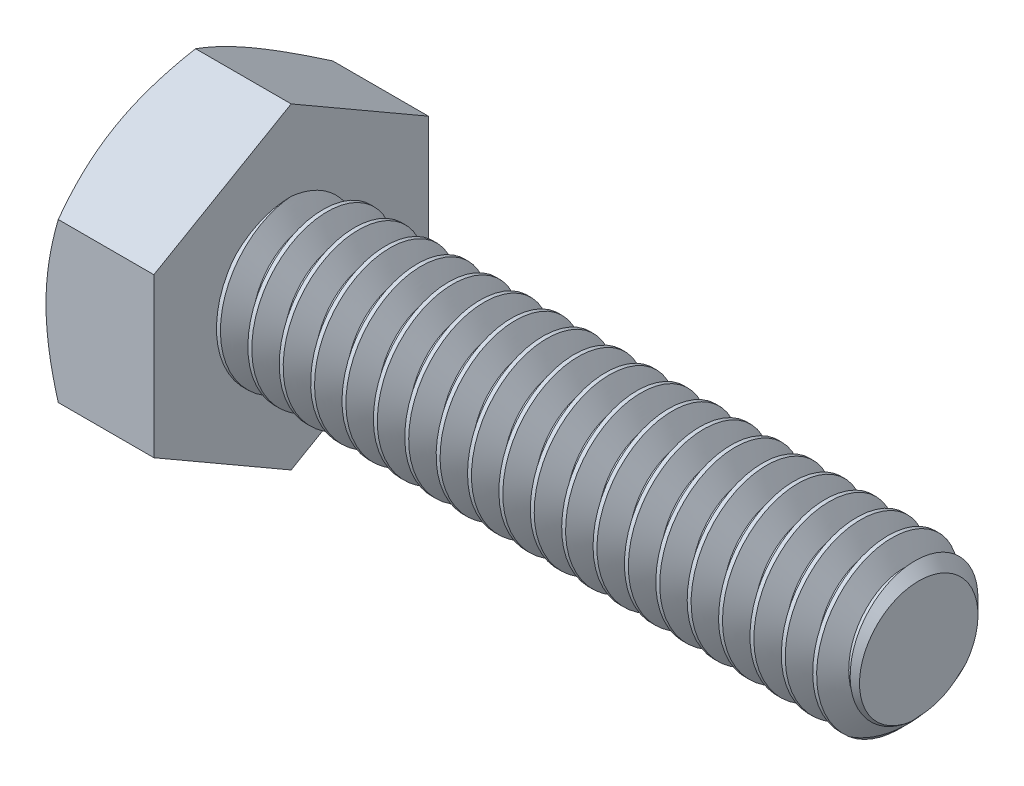
from build123d import *

# Parameters (mm, degrees)
SKETCH5_R           = 3.175
BOSS_EXTRUDE3_DEPTH = 25.4
CHAMFER1_SIZE       = 0.77724
CUT_SWEEP1_PITCH    = 1.27
BOSS_EXTRUDE4_DEPTH = 4.365625
SKETCH8_OUTSIDE_W   = 130.65
SKETCH8_OUTSIDE_H   = 132.37
SKETCH8_OUTSIDE_R   = 5.55625
CUT_EXTRUDE3_DEPTH  = 31.952009727
CUT_EXTRUDE3_DRAFT  = -60
CUT_EXTRUDE4_DEPTH  = 0.254
CIRPATTERN1_COUNT   = 3


with BuildPart() as part:
    # Sketch5 → Boss-Extrude3 (new body)
    with BuildSketch(Plane(origin=(14.8828125, 0, 0), x_dir=(0, 0, -1), z_dir=(1, 0, 0))):
        Circle(SKETCH5_R)
    extrude(amount=-BOSS_EXTRUDE3_DEPTH)

    # Chamfer1
    chamfer1_edges = [part.edges().sort_by_distance(p)[0] for p in [
        (14.8828125, 0, 3.175),
    ]]
    chamfer(chamfer1_edges, length=CHAMFER1_SIZE)

    # Cut-Sweep1: the profile of Sketch10 profile screwed along a right-hand helix of 21 turns, 8 arcs to a turn; built about Z, then put on its axis
    cut_sweep1_z = Axis((0, 0, 0), (0, 0, 1))
    cut_sweep1_corners = [(3.1753, 0, 0.000173205), (2.350110803, 0, -0.47625), (2.350110803, 0, -0.635), (3.1753, 0, -1.111423205)]
    with BuildLine(mode=Mode.PRIVATE) as cut_sweep1_profile:
        Line(cut_sweep1_corners[0], cut_sweep1_corners[1])
        Line(cut_sweep1_corners[1], cut_sweep1_corners[2])
        Line(cut_sweep1_corners[2], cut_sweep1_corners[3])
        Line(cut_sweep1_corners[3], cut_sweep1_corners[0])
    cut_sweep1_cap = Face(cut_sweep1_profile.wire())
    cut_sweep1_turn_angles = [0, 22.5, 45, 67.5, 90, 112.5, 135, 157.5, 180, 202.5, 225, 247.5, 270, 292.5, 315, 337.5, 360]
    cut_sweep1_turn_weights = [1, 0.9238795325112867, 1, 0.9238795325112867, 1, 0.9238795325112867, 1, 0.9238795325112867, 1, 0.9238795325112867, 1, 0.9238795325112867, 1, 0.9238795325112867, 1, 0.9238795325112867, 1]
    cut_sweep1_turn_rails = [Edge.make_bspline([Vector(p[0], p[1], 0).rotate(cut_sweep1_z, cut_sweep1_turn_angles[k]) / cut_sweep1_turn_weights[k] + Vector(0, 0, p[2] + CUT_SWEEP1_PITCH * cut_sweep1_turn_angles[k] / 360) for k in range(17)], [0, 0, 0, 1, 1, 2, 2, 3, 3, 4, 4, 5, 5, 6, 6, 7, 7, 8, 8, 8], 2, cut_sweep1_turn_weights) for p in cut_sweep1_corners]
    cut_sweep1_turn_sides = [Face.make_surface_from_curves(cut_sweep1_turn_rails[p[0]], cut_sweep1_turn_rails[p[1]]) for p in [(0, 1), (1, 2), (2, 3), (3, 0)]]
    cut_sweep1 = Plane(origin=(14.8828125, 0, 0), x_dir=(0, 1, 0), z_dir=(-1, 0, 0)) * Solid(Shell([*[p.moved(Location((0, 0, CUT_SWEEP1_PITCH * i))) for i in range(21) for p in cut_sweep1_turn_sides], cut_sweep1_cap, cut_sweep1_cap.rotate(cut_sweep1_z, 7560).moved(Location((0, 0, CUT_SWEEP1_PITCH * 7560 / 360)))]))
    add(cut_sweep1, mode=Mode.SUBTRACT)

    # Sketch6 → Boss-Extrude4 (add)
    with BuildSketch(Plane.ZY.offset(10.5171875)):
        Polygon((5.55625, 3.207902433), (0, 6.415804866), (-5.55625, 3.207902433), (-5.55625, -3.207902433), (0, -6.415804866), (5.55625, -3.207902433), align=None)
    extrude(amount=BOSS_EXTRUDE4_DEPTH)


with BuildPart() as cut_extrude3_tool:
    # Sketch8 outside → Cut-Extrude3 (with draft: the straight prism first)
    with BuildSketch(Plane.ZY.offset(14.8828125)):
        Rectangle(SKETCH8_OUTSIDE_W, SKETCH8_OUTSIDE_H)
        Circle(SKETCH8_OUTSIDE_R, mode=Mode.SUBTRACT)
    extrude(amount=-CUT_EXTRUDE3_DEPTH)
    # Cut-Extrude3: the draft: its side faces are tilted about the plane it starts from
    cut_extrude3_sides = [cut_extrude3_tool.faces().sort_by_distance(p)[0] for p in [
        (1.093192363, -66.185, 0),
        (1.093192363, 0, 65.325),
        (1.093192363, 66.185, 0),
        (1.093192363, 0, -65.325),
        (1.093192363, 0, -5.55625),
    ]]
    draft(cut_extrude3_sides, Plane.ZY.offset(14.8828125), CUT_EXTRUDE3_DRAFT)


with BuildPart() as part_1:
    add(part.part)

    # Cut-Extrude3: cut by cut_extrude3_tool
    add(cut_extrude3_tool.part, mode=Mode.SUBTRACT)

    # Sketch12 → Cut-Extrude4 (cut)
    with BuildSketch(Plane.ZY.offset(14.8828125)):
        with BuildLine():
            Line((0.1666875, 4.2783125), (0.1666875, 2.3891875))
            ThreePointArc((0.1666875, 2.3891875), (0, 2.2225), (-0.1666875, 2.3891875))
            Line((-0.1666875, 2.3891875), (-0.1666875, 4.2783125))
            ThreePointArc((-0.1666875, 4.2783125), (0, 4.445), (0.1666875, 4.2783125))
        make_face()
    cut_extrude4 = extrude(amount=-CUT_EXTRUDE4_DEPTH, mode=Mode.SUBTRACT)

    # CirPattern1: Cut-Extrude4 ×3 about axis
    cirpattern1_axis = Axis((0, 0, 0), (1, 0, 0))
    for i in range(1, CIRPATTERN1_COUNT):
        add(cut_extrude4.rotate(cirpattern1_axis, i * 360 / CIRPATTERN1_COUNT), mode=Mode.SUBTRACT)


solid = part_1.part
